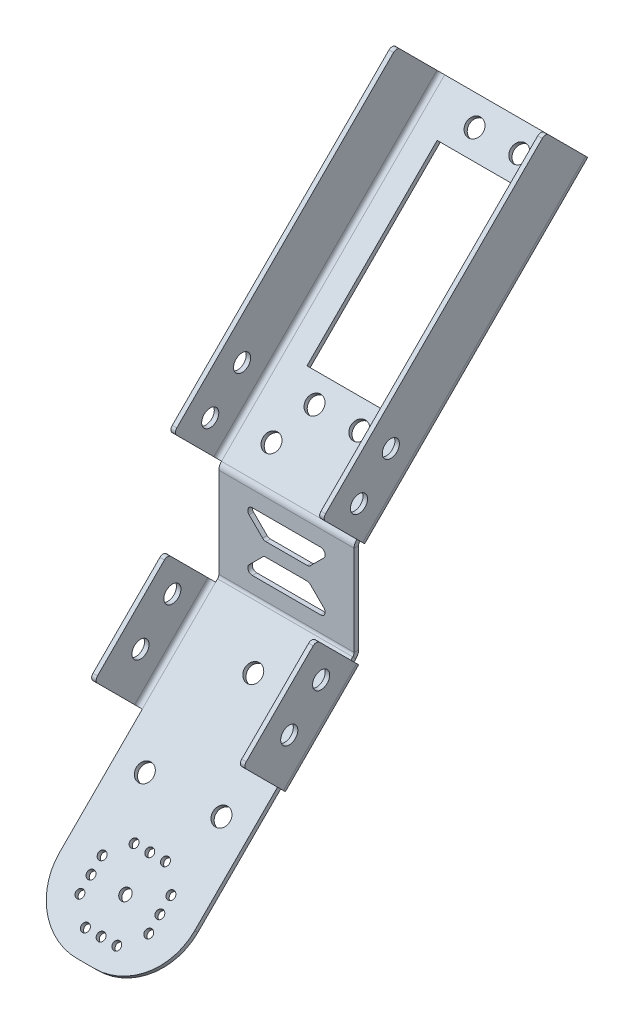
from build123d import *

# Parameters (mm, degrees)
BASE_FLANGE1_DEPTH     = 1
SKETCHED_START         = -30
SKETCHED_BEND5_DEPTH   = 60
SKETCHED_BEND5_2_DEPTH = 15
SKETCHED_START_2       = 15
SKETCHED_BEND5_3_DEPTH = 15
SKETCHED_BEND5_4_DEPTH = 60
SKETCHED_START_3       = -15
SKETCHED_BEND5_5_DEPTH = 30
SKETCHED_BEND6_DEPTH   = 60
SKETCHED_BEND6_2_DEPTH = 15
SKETCHED_BEND6_3_DEPTH = 15
SKETCHED_BEND6_4_DEPTH = 30
SKETCHED_BEND6_5_DEPTH = 60
SKETCHED_START_4       = -28.356310605
SKETCHED_BEND7_DEPTH   = 23
SKETCHED_BEND7_2_DEPTH = 23
SKETCHED_START_5       = 11.547743288
SKETCHED_BEND8_DEPTH   = 70
SKETCHED_BEND8_2_DEPTH = 70
SKETCH36_W             = 19.9
SKETCH36_H             = 40.84
CUT_EXTRUDE1_DEPTH     = 10
F_6_CLEARANCE_HOLE4_D  = 3.7973
F_6_CLEARANCE_HOLE2_D  = 3.7973
M1_6_CLEARANCE_HOLE1_D = 1.8
FILLET2_R              = 13
F_2_CLEARANCE_HOLE1_D  = 2.4384
CUT_EXTRUDE2_DEPTH     = 10
FILLET1_R              = 1


# Read off the part's stored shape, not the designer's step: Sketched Bend5, Sketched Bend6, Sketched Bend7, Sketched Bend8
# Sheet-metal steps are written as plain solids
with BuildPart() as part:
    # Sketch1 → Base-Flange1 (new body)
    with BuildSketch(Plane.XY):
        Polygon((-30, -30.5), (-15, -30.5), (-15, -69.5), (15, -69.5), (15, -30.5), (30, -30.5), (30, -7.5), (15, -7.5), (15, 15.5), (30, 15.5), (30, 85.5), (-30, 85.5), (-30, 15.5), (-15, 15.5), (-15, -7.5), (-30, -7.5), align=None)
    extrude(amount=-BASE_FLANGE1_DEPTH)

    # Sketched Bend5 outline → Sketched Bend5 (cut)
    with BuildSketch(Plane.YZ.offset(SKETCHED_START)):
        with BuildLine():
            Line((15.714213562, -0.585786438), (16.128427124, -1))
            Line((16.128427124, -1), (85.5, -1))
            Line((85.5, -1), (85.5, 0))
            Line((85.5, 0), (14.3, 0))
            ThreePointArc((14.3, 0), (15.065366865, -0.152240935), (15.714213562, -0.585786438))
        make_face()
    extrude(amount=SKETCHED_BEND5_DEPTH, mode=Mode.SUBTRACT)

    # Sketched Bend5 2 outline → Sketched Bend5 2 (cut)
    with BuildSketch(Plane.YZ.offset(SKETCHED_START)):
        with BuildLine():
            Line((15.729701149, -0.601274024), (15.714213562, -0.585786438))
            ThreePointArc((15.714213562, -0.585786438), (15.610403483, -0.48909209), (15.5, -0.4))
            Line((15.5, -0.4), (15.5, -0.830975173))
            Line((15.5, -0.830975173), (15.729701149, -0.601274024))
        make_face()
    extrude(amount=SKETCHED_BEND5_2_DEPTH, mode=Mode.SUBTRACT)

    # Sketched Bend5 3 outline → Sketched Bend5 3 (cut)
    with BuildSketch(Plane.YZ.offset(SKETCHED_START_2)):
        with BuildLine():
            Line((15.729701149, -0.601274024), (15.714213562, -0.585786438))
            ThreePointArc((15.714213562, -0.585786438), (15.610403483, -0.48909209), (15.5, -0.4))
            Line((15.5, -0.4), (15.5, -0.830975173))
            Line((15.5, -0.830975173), (15.729701149, -0.601274024))
        make_face()
    extrude(amount=SKETCHED_BEND5_3_DEPTH, mode=Mode.SUBTRACT)

    # Sketched Bend5 4 outline → Sketched Bend5 4 (add)
    with BuildSketch(Plane.YZ.offset(SKETCHED_START)):
        Polygon((65.227175832, -50.098748707), (16.128427124, -1), (15.5, -1), (15.5, -0.830975173), (15.022594368, -1.308380805), (64.520069051, -50.805855488), align=None)
    extrude(amount=SKETCHED_BEND5_4_DEPTH)

    # Sketched Bend5 5 outline → Sketched Bend5 5 (add)
    with BuildSketch(Plane.YZ.offset(SKETCHED_START_3)):
        with BuildLine():
            Line((15.022594368, -1.308380805), (15.330975173, -1))
            Line((15.330975173, -1), (14.3, -1))
            ThreePointArc((14.3, -1), (14.682683432, -1.076120467), (15.007106781, -1.292893219))
            Line((15.007106781, -1.292893219), (15.022594368, -1.308380805))
        make_face()
    extrude(amount=SKETCHED_BEND5_5_DEPTH)

    # Sketched Bend6 outline → Sketched Bend6 (cut)
    with BuildSketch(Plane.YZ.offset(SKETCHED_START)):
        with BuildLine():
            ThreePointArc((-5.710951377, -1), (-6.476318242, -0.847759065), (-7.12516494, -0.414213562))
            Line((-7.12516494, -0.414213562), (-7.539378502, 0))
            Line((-7.539378502, 0), (-69.5, 0))
            Line((-69.5, 0), (-69.5, -1))
            Line((-69.5, -1), (-5.710951377, -1))
        make_face()
    extrude(amount=SKETCHED_BEND6_DEPTH, mode=Mode.SUBTRACT)

    # Sketched Bend6 2 outline → Sketched Bend6 2 (cut)
    with BuildSketch(Plane.YZ.offset(SKETCHED_START)):
        Polygon((-7.539378502, 0), (-7.5, -0.039378502), (-7.5, 0), align=None)
    extrude(amount=SKETCHED_BEND6_2_DEPTH, mode=Mode.SUBTRACT)

    # Sketched Bend6 3 outline → Sketched Bend6 3 (cut)
    with BuildSketch(Plane.YZ.offset(SKETCHED_START_2)):
        Polygon((-7.539378502, 0), (-7.5, -0.039378502), (-7.5, 0), align=None)
    extrude(amount=SKETCHED_BEND6_3_DEPTH, mode=Mode.SUBTRACT)

    # Sketched Bend6 4 outline → Sketched Bend6 4 (add)
    with BuildSketch(Plane.YZ.offset(SKETCHED_START_3)):
        with BuildLine():
            Line((-7.539378502, 0), (-5.710951377, 0))
            ThreePointArc((-5.710951377, 0), (-6.09363481, 0.076120467), (-6.418058159, 0.292893219))
            Line((-6.418058159, 0.292893219), (-50.690686454, 44.565521514))
            Line((-50.690686454, 44.565521514), (-51.397793235, 43.858414733))
            Line((-51.397793235, 43.858414733), (-7.539378502, 0))
        make_face()
    extrude(amount=SKETCHED_BEND6_4_DEPTH)

    # Sketched Bend6 5 outline → Sketched Bend6 5 (add)
    with BuildSketch(Plane.YZ.offset(SKETCHED_START)):
        Polygon((-23.820628769, 16.281250267), (-7.557172802, 0.0177943), (-6.850066021, 0.724901081), (-23.113521988, 16.988357048), align=None)
    extrude(amount=SKETCHED_BEND6_5_DEPTH)

    # Sketched Bend7 outline → Sketched Bend7 (cut)
    with BuildSketch(Plane(origin=(0, 0, 0), x_dir=(1, 0, 0), z_dir=(0, 0.707106781186546, -0.707106781186549)).offset(SKETCHED_START_4)):
        with BuildLine():
            ThreePointArc((-16.732050807, 4.331145665), (-16, 5.063196472), (-15, 5.331145665))
            Line((-15, 5.331145665), (-30, 5.331145665))
            Line((-30, 5.331145665), (-30, 4.331145665))
            Line((-30, 4.331145665), (-16.732050807, 4.331145665))
        make_face()
        with BuildLine():
            Line((30, 5.331145665), (15, 5.331145665))
            ThreePointArc((15, 5.331145665), (16, 5.063196472), (16.732050807, 4.331145665))
            Line((16.732050807, 4.331145665), (30, 4.331145665))
            Line((30, 4.331145665), (30, 5.331145665))
        make_face()
    extrude(amount=SKETCHED_BEND7_DEPTH, mode=Mode.SUBTRACT)

    # Sketched Bend7 2 outline → Sketched Bend7 2 (add)
    with BuildSketch(Plane(origin=(0, 0, 0), x_dir=(1, 0, 0), z_dir=(0, 0.707106781186546, -0.707106781186549)).offset(SKETCHED_START_4)):
        with BuildLine():
            Line((-15, 4.331145665), (-16.732050807, 4.331145665))
            ThreePointArc((-16.732050807, 4.331145665), (-16.931851652, 3.848783755), (-17, 3.331145665))
            Line((-17, 3.331145665), (-17, -9.312659845))
            Line((-17, -9.312659845), (-16, -9.312659845))
            Line((-16, -9.312659845), (-16, 3.331145665))
            ThreePointArc((-16, 3.331145665), (-15.707106781, 4.038252446), (-15, 4.331145665))
        make_face()
        with BuildLine():
            ThreePointArc((17, 3.331145665), (16.931851652, 3.848783755), (16.732050807, 4.331145665))
            Line((16.732050807, 4.331145665), (15, 4.331145665))
            ThreePointArc((15, 4.331145665), (15.707106781, 4.038252446), (16, 3.331145665))
            Line((16, 3.331145665), (16, -9.312659845))
            Line((16, -9.312659845), (17, -9.312659845))
            Line((17, -9.312659845), (17, 3.331145665))
        make_face()
    extrude(amount=SKETCHED_BEND7_2_DEPTH)

    # Sketched Bend8 outline → Sketched Bend8 (cut)
    with BuildSketch(Plane(origin=(0, 0, 0), x_dir=(1, 0, 0), z_dir=(0, 0.707106781186546, -0.707106781186549)).offset(SKETCHED_START_5)):
        with BuildLine():
            Line((-30, -10.697413409), (-16.732050808, -10.697413409))
            ThreePointArc((-16.732050808, -10.697413409), (-16, -9.965362601), (-15, -9.697413409))
            Line((-15, -9.697413409), (-30, -9.697413409))
            Line((-30, -9.697413409), (-30, -10.697413409))
        make_face()
        with BuildLine():
            Line((30, -9.697413409), (15, -9.697413409))
            ThreePointArc((15, -9.697413409), (16, -9.965362601), (16.732050808, -10.697413409))
            Line((16.732050808, -10.697413409), (30, -10.697413409))
            Line((30, -10.697413409), (30, -9.697413409))
        make_face()
    extrude(amount=SKETCHED_BEND8_DEPTH, mode=Mode.SUBTRACT)

    # Sketched Bend8 2 outline → Sketched Bend8 2 (add)
    with BuildSketch(Plane(origin=(0, 0, 0), x_dir=(1, 0, 0), z_dir=(0, 0.707106781186546, -0.707106781186549)).offset(SKETCHED_START_5)):
        with BuildLine():
            ThreePointArc((-16.732050808, -10.697413409), (-16.931851653, -11.179775319), (-17, -11.697413409))
            Line((-17, -11.697413409), (-17, -24.341218918))
            Line((-17, -24.341218918), (-16, -24.341218918))
            Line((-16, -24.341218918), (-16, -11.697413409))
            ThreePointArc((-16, -11.697413409), (-15.707106781, -10.990306628), (-15, -10.697413409))
            Line((-15, -10.697413409), (-16.732050808, -10.697413409))
        make_face()
        with BuildLine():
            Line((16.732050808, -10.697413409), (15, -10.697413409))
            ThreePointArc((15, -10.697413409), (15.707106781, -10.990306628), (16, -11.697413409))
            Line((16, -11.697413409), (16, -24.341218918))
            Line((16, -24.341218918), (17, -24.341218918))
            Line((17, -24.341218918), (17, -11.697413409))
            ThreePointArc((17, -11.697413409), (16.931851653, -11.179775319), (16.732050808, -10.697413409))
        make_face()
    extrude(amount=SKETCHED_BEND8_2_DEPTH)

    # Sketch36 → Cut-Extrude1 (cut)
    with BuildSketch(Plane(origin=(0, 7.564213562, 7.564213562), x_dir=(1, 0, 0), z_dir=(0, 0.7071067811865487, 0.7071067811865465))):
        with Locations((0, 51.627743288)):
            Rectangle(SKETCH36_W, SKETCH36_H)
    extrude(amount=-CUT_EXTRUDE1_DEPTH, mode=Mode.SUBTRACT)

    # #6 Clearance Hole4 (through all)
    with Locations(Plane(origin=(0, 7.564213562, 7.564213562), x_dir=(1, 0, 0), z_dir=(0, 0.7071067811865487, 0.7071067811865465))):
        with Locations((-4.97, 76.727743288), (4.97, 76.727743288), (-4.97, 26.527743288), (4.97, 26.527743288), (-8.5, 18.025840533), (8.5, 18.025840533), (0, -14.745359227), (-8.5, -36.745359227), (8.5, -36.745359227)):
            Hole(F_6_CLEARANCE_HOLE4_D / 2)

    # #6 Clearance Hole2 (through all)
    with Locations(Plane(origin=(17, 0, 0), x_dir=(0, 0, -1), z_dir=(1, 0, 0))):
        with Locations((-9.311868306, -5.334166607), (-16.382936118, -12.405234419), (-0.914625389, 24.316668374), (6.156442422, 31.387736186)):
            Hole(F_6_CLEARANCE_HOLE2_D / 2)

    # M1.6 Clearance Hole1 (through all)
    with Locations(Plane(origin=(0, -3.06258247, -3.06258247), x_dir=(1, 0, 0), z_dir=(0, 0.7071067811865487, 0.7071067811865465))):
        with Locations((0, -47.221310605), (-3.48, -47.221310605), (3.48, -47.221310605), (-3.48, -62.491310605), (0, -62.491310605), (3.48, -62.491310605), (7.635, -58.336310605), (7.635, -54.856310605), (7.635, -51.376310605), (-7.635, -58.336310605), (-7.635, -54.856310605), (-7.635, -51.376310605)):
            Hole(M1_6_CLEARANCE_HOLE1_D / 2)

    # Fillet2
    fillet2_edges = [part.edges().sort_by_distance(p)[0] for p in [
        (-15, -51.044239844, 44.211968124),
        (15, -51.044239844, 44.211968124),
    ]]
    fillet(fillet2_edges, radius=FILLET2_R)

    # #2 Clearance Hole1 (through all)
    with Locations(Plane(origin=(0, -3.769689251, -3.769689251), x_dir=(-1, 0, 0), z_dir=(0, -0.7071067811865487, -0.7071067811865465))):
        with Locations((0, -54.856310605)):
            Hole(F_2_CLEARANCE_HOLE1_D / 2)

    # Sketch51 → Cut-Extrude2 (cut)
    with BuildSketch(Plane.XY):
        Polygon((-10, 10.8), (10, 10.8), (5, 5.8), (-5, 5.8), align=None)
        Polygon((-5, 2.789048623), (5, 2.789048623), (10, -2.210951377), (-10, -2.210951377), align=None)
    extrude(amount=-CUT_EXTRUDE2_DEPTH, mode=Mode.SUBTRACT)

    # Fillet1
    fillet1_edges = [part.edges().sort_by_distance(p)[0] for p in [
        (-16.5, -13.465894591, 26.635984446),
        (-16.5, 2.797561376, 10.372528478),
        (16.5, 2.797561376, 10.372528478),
        (16.5, -13.465894591, 26.635984446),
        (-16.5, 25.377328546, 9.046353373),
        (-16.5, 74.874803229, -40.45112131),
        (16.5, 74.874803229, -40.45112131),
        (16.5, 25.377328546, 9.046353373),
        (-5, 5.8, -0.5),
        (-10, 10.8, -0.5),
        (10, 10.8, -0.5),
        (5, 5.8, -0.5),
        (-10, -2.210951377, -0.5),
        (-5, 2.789048623, -0.5),
        (5, 2.789048623, -0.5),
        (10, -2.210951377, -0.5),
    ]]
    fillet(fillet1_edges, radius=FILLET1_R)


solid = part.part
